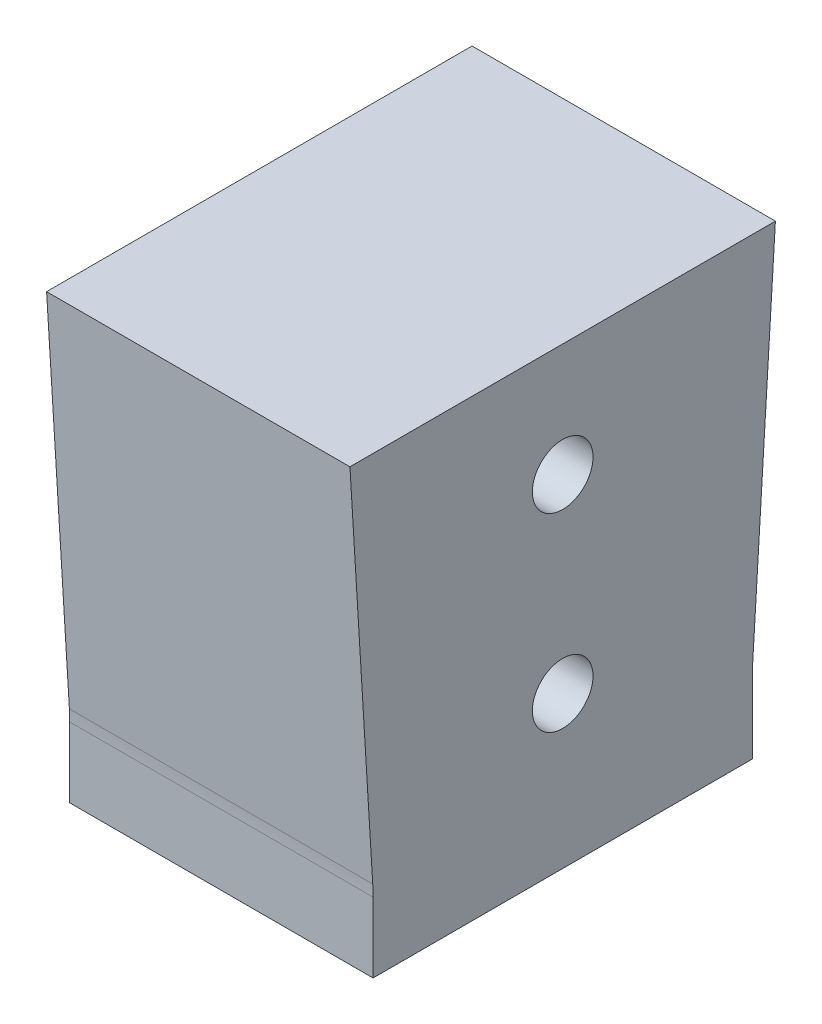
from build123d import *

# Parameters (mm, degrees)
EXTRUDE_1_REACH          = 32.84
EXTRUDE_1_END_RADIUS     = 17
SKETCH_4_W               = 16
SKETCH_4_H               = 20
SKETCH_7_R               = 1.6
EXTRUDE_2_DEPTH          = 8
FILLET_1_R               = 2
CUT_EXTRUDE_1_DEPTH      = 10
CUT_EXTRUDE_1_DEPTH_BACK = 28
SKETCH_9_W               = 16
SKETCH_9_H               = 20
EXTRUDE_3_DEPTH          = 4
FILLET_2_R               = 10


with BuildPart() as part:
    # 草图1 → 旋转1 (revolve)
    with BuildSketch(Plane.XY):
        with BuildLine():
            Line((0, 8.148347953), (0, 15.148347953))
            ThreePointArc((0, 15.148347953), (-9.649034823, 12.144637711), (-15.888316149, 4.194951128))
            ThreePointArc((-15.888316149, 4.194951128), (-15.414532258, 2.711018861), (-13.862245394, 2.841140494))
            ThreePointArc((-13.862245394, 2.841140494), (-8.835262424, 6.313648333), (-3, 8.124333536))
            Line((-3, 8.124333536), (-3, -5.851652047))
            Line((-3, -5.851652047), (0, -5.851652047))
            Line((0, -5.851652047), (0, 8.148347953))
        make_face()
    revolve(axis=Axis((0, 30.990444744, 0), (0, -1, 0)))

    # 凸台-拉伸1: up to this sphere (the profile starts outside it)
    extrude_1_end = Location((0, -1.851652047, 0)) * Sphere(EXTRUDE_1_END_RADIUS, mode=Mode.PRIVATE)
    # 草图4 → 凸台-拉伸1 (add, up to the surface)
    with BuildSketch(Plane(origin=(0, 15.148347953, 0), x_dir=(-1, 0, 0), z_dir=(0, -1, 0)), mode=Mode.PRIVATE) as extrude_1_sk1:
        Rectangle(SKETCH_4_W, SKETCH_4_H)
    extrude_1_tool1 = extrude(extrude_1_sk1.sketch, amount=EXTRUDE_1_REACH, mode=Mode.PRIVATE) - extrude_1_end
    add(extrude_1_tool1.solids().sort_by_distance((0, 15.148348, 0))[0])

    # 草图7 → 凸台-拉伸2 (add, symmetric)
    with BuildSketch(Plane(origin=(0, 0, 0), x_dir=(0, 0, -1), z_dir=(1, 0, 0))):
        Polygon((-10, 15.148347953), (-11.220970791, 35.111043921), (11.220970791, 35.111043921), (10, 15.148347953), align=None)
        with Locations((0, 29.148347953)):
            Circle(SKETCH_7_R, mode=Mode.SUBTRACT)
        with Locations((0, 19.148347953)):
            Circle(SKETCH_7_R, mode=Mode.SUBTRACT)
    extrude(amount=EXTRUDE_2_DEPTH, both=True)

    # 圆角1
    fillet_1_edges = [part.edges().sort_by_distance(p)[0] for p in [
        (3, 8.124333536, 0),
    ]]
    fillet(fillet_1_edges, radius=FILLET_1_R)

    # 草图8 → 切除-拉伸1 (cut, two sides: drawn at the far end of the back side and taken through both)
    with BuildSketch(Plane(origin=(8, 0, 0), x_dir=(0, 0, -1), z_dir=(1, 0, 0)).offset(-CUT_EXTRUDE_1_DEPTH_BACK)):
        Polygon((-10, 15.148347953), (10, 15.148347953), (22.074384404, 15.148347953), (22.074384404, -11.334225307), (-23.122772671, -11.334225307), (-23.122772671, 15.148347953), align=None)
    extrude(amount=CUT_EXTRUDE_1_DEPTH + CUT_EXTRUDE_1_DEPTH_BACK, mode=Mode.SUBTRACT)

    # 草图9 → 凸台-拉伸3 (add)
    with BuildSketch(Plane.XZ.offset(-15.148347953)):
        Rectangle(SKETCH_9_W, SKETCH_9_H)
    extrude(amount=EXTRUDE_3_DEPTH)

    # 圆角2
    # the kernel refuses this fillet: 10 mm, written as the material it adds along each edge
    with BuildSketch(Plane(origin=(8, 15.148347953, 10), x_dir=(0, 0.9981347984218685, 0.061048539534831796), z_dir=(-1, 0, 0)), Plane(origin=(-8, 15.148347953, -10), x_dir=(0, 0.9981347984218659, -0.06104853953487234), z_dir=(1, 0, 0))) as fillet_2_piece_1:
        with BuildLine():
            CenterArc((FILLET_2_R * 0.0305527632986, -FILLET_2_R), FILLET_2_R, 90, 3.5)
            Line((-FILLET_2_R * 0.0304957762363, -FILLET_2_R * 0.00186520157813), (0, 0))
            Line((0, 0), (FILLET_2_R * 0.0305527632986, 0))
        make_face()
    extrude(amount=16)


solid = part.part
